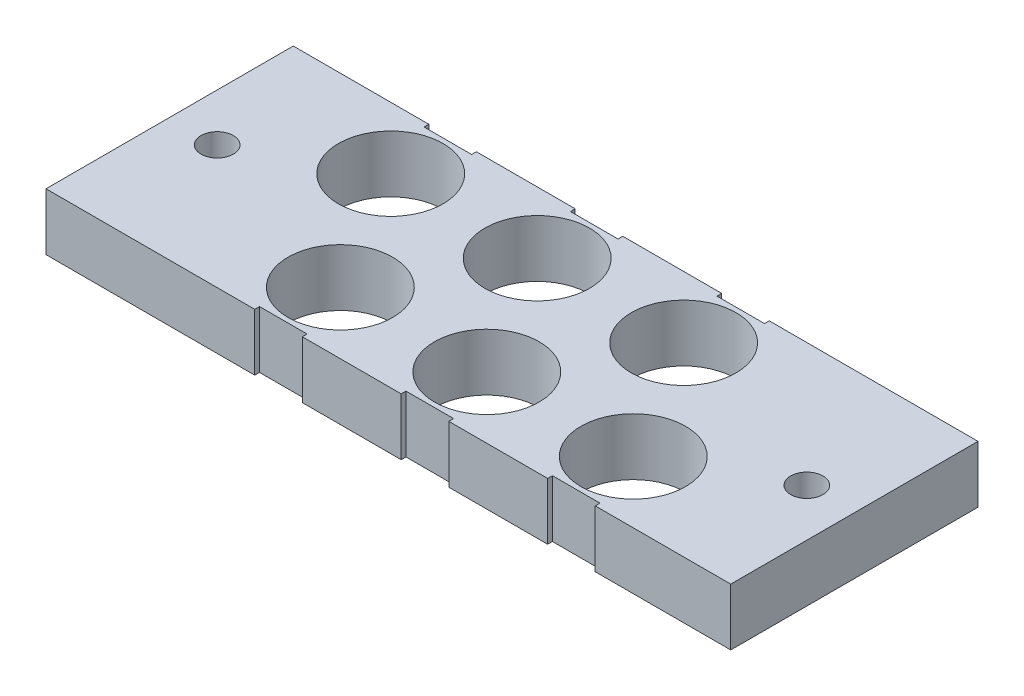
from build123d import *

# Parameters (mm, degrees)
SKETCH1_R               = 5.5
BOSS_EXTRUDE1_DEPTH     = 6
BOSS_EXTRUDE1_2_DEPTH   = 6
BOSS_EXTRUDE1_3_DEPTH   = 6
BOSS_EXTRUDE1_4_DEPTH   = 6
BOSS_EXTRUDE1_5_DEPTH   = 6
BOSS_EXTRUDE1_6_DEPTH   = 6
BOSS_EXTRUDE2_START     = -6
BOSS_EXTRUDE2_OUTLINE_R = 1.7
BOSS_EXTRUDE2_DEPTH     = 6
CUT_EXTRUDE1_DEPTH      = 1


# Read off the part's stored shape, not the designer's step: Boss-Extrude2
with BuildPart() as part:
    # Sketch1 → Boss-Extrude1 (new body)
    with BuildSketch(Plane(origin=(0, 0, 0), x_dir=(1, 0, 0), z_dir=(0, 1, 0))):
        Polygon((3.686387934, -16.664883738), (3.686388262, -4.664883738), (-8.313611738, -4.66488341), (-8.313612066, -16.66488341), align=None)
        with Locations(Location((-2.313611902, -10.664883574, 0), (0, 0, 270))):
            Circle(SKETCH1_R, mode=Mode.SUBTRACT)
    extrude(amount=-BOSS_EXTRUDE1_DEPTH)



with BuildPart() as body_2:
    # Sketch1 → Boss-Extrude1 2 (new body)
    with BuildSketch(Plane(origin=(0, 0, 0), x_dir=(1, 0, 0), z_dir=(0, 1, 0))):
        Polygon((19.086387939, -16.664884095), (19.086388267, -4.664884095), (7.086388267, -4.664883767), (7.086387939, -16.664883767), align=None)
        with Locations(Location((13.086388103, -10.664883931, 0), (0, 0, 270))):
            Circle(SKETCH1_R, mode=Mode.SUBTRACT)
    extrude(amount=-BOSS_EXTRUDE1_2_DEPTH)


with BuildPart() as body_3:
    # Sketch1 → Boss-Extrude1 3 (new body)
    with BuildSketch(Plane(origin=(0, 0, 0), x_dir=(1, 0, 0), z_dir=(0, 1, 0))):
        Polygon((34.486387949, -16.66488445), (34.486388277, -4.66488445), (22.486388277, -4.664884122), (22.486387949, -16.664884122), align=None)
        with Locations(Location((28.486388113, -10.664884286, 0), (0, 0, 270))):
            Circle(SKETCH1_R, mode=Mode.SUBTRACT)
    extrude(amount=-BOSS_EXTRUDE1_3_DEPTH)


with BuildPart() as body_4:
    # Sketch1 → Boss-Extrude1 4 (new body)
    with BuildSketch(Plane(origin=(0, 0, 0), x_dir=(1, 0, 0), z_dir=(0, 1, 0))):
        Polygon((14.786387887, -17.664883977), (14.786387559, -29.664883977), (26.786387559, -29.664884305), (26.786387887, -17.664884305), align=None)
        with Locations(Location((20.786387723, -23.664884141, 0), (0, 0, 270))):
            Circle(SKETCH1_R, mode=Mode.SUBTRACT)
    extrude(amount=-BOSS_EXTRUDE1_4_DEPTH)


with BuildPart() as body_5:
    # Sketch1 → Boss-Extrude1 5 (new body)
    with BuildSketch(Plane(origin=(0, 0, 0), x_dir=(1, 0, 0), z_dir=(0, 1, 0))):
        Polygon((30.186386338, -17.664884333), (30.18638601, -29.664884333), (42.18638601, -29.664884661), (42.186386338, -17.664884661), align=None)
        with Locations(Location((36.186386174, -23.664884497, 0), (0, 0, 270))):
            Circle(SKETCH1_R, mode=Mode.SUBTRACT)
    extrude(amount=-BOSS_EXTRUDE1_5_DEPTH)


with BuildPart() as body_6:
    # Sketch1 → Boss-Extrude1 6 (new body)
    with BuildSketch(Plane(origin=(0, 0, 0), x_dir=(1, 0, 0), z_dir=(0, 1, 0))):
        Polygon((-0.613612103, -17.664883618), (-0.613612431, -29.664883618), (11.386387569, -29.664883947), (11.386387897, -17.664883947), align=None)
        with Locations(Location((5.386387733, -23.664883782, 0), (0, 0, 270))):
            Circle(SKETCH1_R, mode=Mode.SUBTRACT)
    extrude(amount=-BOSS_EXTRUDE1_6_DEPTH)


with BuildPart() as part_1:
    add(part.part)

    add(body_2.part)  # Boss-Extrude2 merges body 2

    add(body_3.part)  # Boss-Extrude2 merges body 3

    add(body_4.part)  # Boss-Extrude2 merges body 4

    add(body_5.part)  # Boss-Extrude2 merges body 5

    add(body_6.part)  # Boss-Extrude2 merges body 6
    # Boss-Extrude2 outline → Boss-Extrude2 (add)
    with BuildSketch(Plane(origin=(0, 0, 0), x_dir=(1, 0, 0), z_dir=(0, 1, 0)).offset(BOSS_EXTRUDE2_START)):
        Polygon((10.586388281, -4.164883862), (0.186388276, -4.164883578), (0.186388262, -4.664883642), (3.686388262, -4.664883738), (3.686387934, -16.664883738), (-8.313612066, -16.66488341), (-8.313611738, -4.66488341), (-4.813611738, -4.664883506), (-4.813611724, -4.164883505), (-19.063611735, -4.164883116), (-19.063612446, -30.164883114), (2.886387555, -30.164883714), (2.886387569, -29.664883714), (-0.613612431, -29.664883618), (-0.613612103, -17.664883618), (11.386387897, -17.664883947), (11.386387569, -29.664883947), (7.886387569, -29.664883851), (7.886387555, -30.164883851), (18.286387545, -30.164884073), (18.286387559, -29.664884073), (14.786387559, -29.664883977), (14.786387887, -17.664883977), (26.786387887, -17.664884305), (26.786387559, -29.664884305), (23.286387559, -29.664884209), (23.286387545, -30.16488421), (33.686385997, -30.164884494), (33.68638601, -29.664884428), (30.18638601, -29.664884333), (30.186386338, -17.664884333), (42.186386338, -17.664884661), (42.18638601, -29.664884661), (38.68638601, -29.664884565), (38.686385997, -30.164884565), (52.936387554, -30.164884954), (52.936388265, -4.164885084), (30.986388291, -4.164884354), (30.986388277, -4.664884354), (34.486388277, -4.66488445), (34.486387949, -16.66488445), (22.486387949, -16.664884122), (22.486388277, -4.664884122), (25.986388277, -4.664884218), (25.986388291, -4.164884218), (15.586388281, -4.164884108), (15.586388267, -4.664883999), (19.086388267, -4.664884095), (19.086387939, -16.664884095), (7.086387939, -16.664883767), (7.086388267, -4.664883767), (10.586388267, -4.664883863), align=None)
        with Locations((47.93638791, -17.164884883)):
            Circle(BOSS_EXTRUDE2_OUTLINE_R, mode=Mode.SUBTRACT)
        with Locations((-14.06361209, -17.164883252)):
            Circle(BOSS_EXTRUDE2_OUTLINE_R, mode=Mode.SUBTRACT)
    extrude(amount=BOSS_EXTRUDE2_DEPTH)

    # Sketch2 → Cut-Extrude1 (cut)
    # profile 1 of 2: a face of its own
    with BuildSketch(Plane(origin=(0, -6, 0), x_dir=(-1, 0, 0), z_dir=(0, -1, 0))):
        Polygon((6.544081332, -23.739762668), (8.090876204, -23.739762668), (8.090876204, -24.065403693), (6.829017229, -24.065403693), (6.829017229, -25.04232677), (8.090876204, -25.04232677), (8.090876204, -25.367967796), (6.829017229, -25.367967796), (6.829017229, -26.914762668), (6.544081332, -26.914762668), align=None)
    # profile 2 of 2: a face of its own
    with BuildSketch(Plane(origin=(0, -6, 0), x_dir=(-1, 0, 0), z_dir=(0, -1, 0))):
        Polygon((10.108960138, -23.658352411), (10.166837742, -23.658352411), (10.166837742, -25.856429335), (10.533183896, -25.856429335), (10.533183896, -26.18207036), (10.166837742, -26.18207036), (10.166837742, -26.914762668), (9.881901845, -26.914762668), (9.881901845, -26.18207036), (8.375812101, -26.18207036), align=None)
        Polygon((9.881901845, -25.856429335), (9.881901845, -24.478815152), (8.936143631, -25.856429335), align=None, mode=Mode.SUBTRACT)
    extrude(amount=-CUT_EXTRUDE1_DEPTH, mode=Mode.SUBTRACT)


solid = part_1.part
